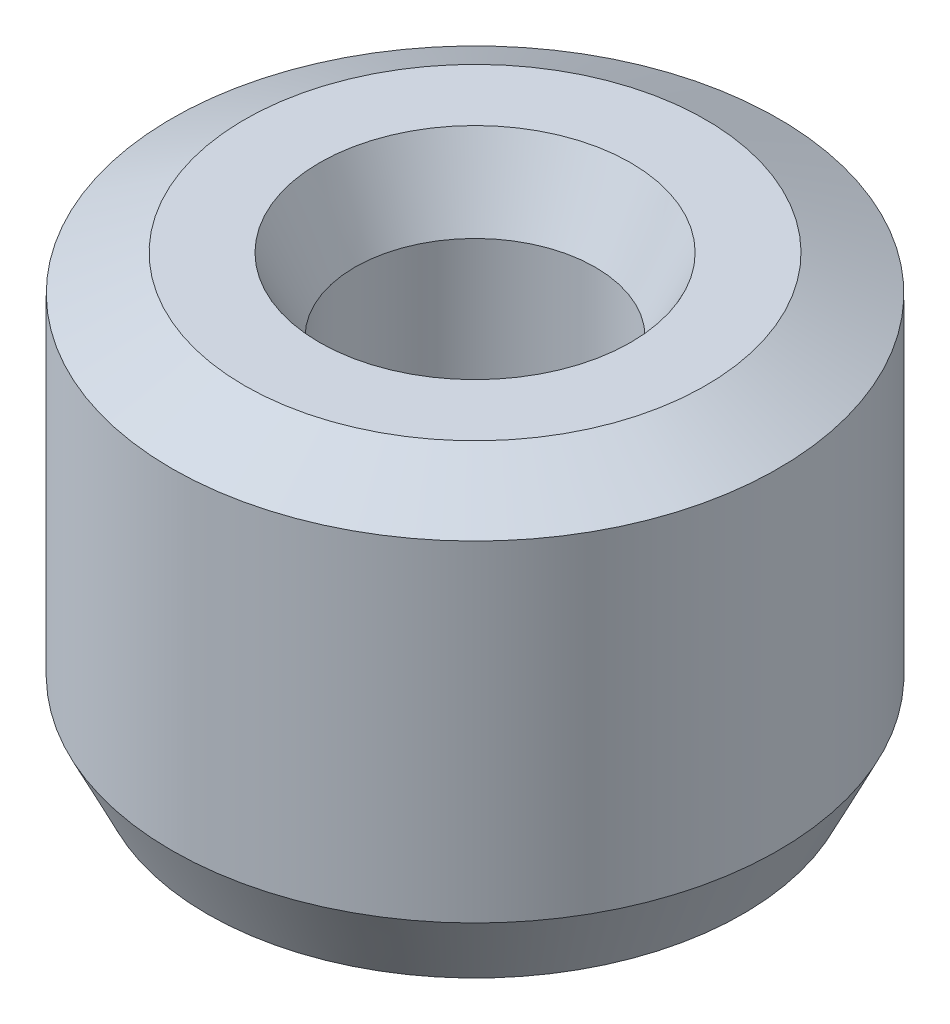
from build123d import *
from OCP.BRepFilletAPI import BRepFilletAPI_MakeChamfer

# Parameters (mm, degrees)
SKETCH1_R           = 12.5
BOSS_EXTRUDE1_DEPTH = 18.094022058
SKETCH2_R           = 4.955152252
CUT_EXTRUDE1_DEPTH  = 26.296118956
CHAMFER1_SIZE       = 1.460521096
CHAMFER1_SIZE2      = 2.997964707


with BuildPart() as part:
    # Sketch1 → Boss-Extrude1 (new body)
    with BuildSketch(Plane(origin=(0, 0, 0), x_dir=(1, 0, 0), z_dir=(0, 1, 0))):
        Circle(SKETCH1_R)
    extrude(amount=BOSS_EXTRUDE1_DEPTH)

    # Sketch2 → Cut-Extrude1 (cut, through all)
    with BuildSketch(Plane(origin=(0, 0, 0), x_dir=(1, 0, 0), z_dir=(0, 1, 0))):
        Circle(SKETCH2_R)
    extrude(amount=CUT_EXTRUDE1_DEPTH, mode=Mode.SUBTRACT)

    # Chamfer1: one chamfer whose edges measure the first distance from different faces: ONE call of the kernel's chamfer builder (chamfer() names one face for all edges)
    chamfer1_edges_1 = [part.edges().sort_by_distance(p)[0] for p in [
        (-4.955152252, 18.094022058, 0),
    ]]
    chamfer1_side_1 = [part.faces().sort_by_distance(p)[0] for p in [
        (-12.146446609, 18.094022058, 0),
    ]]
    chamfer1_edges_2 = [part.edges().sort_by_distance(p)[0] for p in [
        (-4.955152252, 0, 0),
    ]]
    chamfer1_side_2 = [part.faces().sort_by_distance(p)[0] for p in [
        (-4.955152252, 9.047011029, 0),
    ]]
    chamfer1_edges_3 = [part.edges().sort_by_distance(p)[0] for p in [
        (-12.5, 0, 0),
    ]]
    chamfer1_side_3 = [part.faces().sort_by_distance(p)[0] for p in [
        (-12.146446609, 0, 0),
    ]]
    chamfer1_edges_4 = [part.edges().sort_by_distance(p)[0] for p in [
        (-12.5, 18.094022058, 0),
    ]]
    chamfer1_side_4 = [part.faces().sort_by_distance(p)[0] for p in [
        (-12.5, 9.047011029, 0),
    ]]
    chamfer1 = BRepFilletAPI_MakeChamfer(part.part.solid().wrapped)
    for e in chamfer1_edges_1:
        chamfer1.Add(CHAMFER1_SIZE, CHAMFER1_SIZE2, e.wrapped, chamfer1_side_1[0].wrapped)  # the first distance lies on this face
    for e in chamfer1_edges_2:
        chamfer1.Add(CHAMFER1_SIZE, CHAMFER1_SIZE2, e.wrapped, chamfer1_side_2[0].wrapped)  # the first distance lies on this face
    for e in chamfer1_edges_3:
        chamfer1.Add(CHAMFER1_SIZE, CHAMFER1_SIZE2, e.wrapped, chamfer1_side_3[0].wrapped)  # the first distance lies on this face
    for e in chamfer1_edges_4:
        chamfer1.Add(CHAMFER1_SIZE, CHAMFER1_SIZE2, e.wrapped, chamfer1_side_4[0].wrapped)  # the first distance lies on this face
    add(Compound.cast(chamfer1.Shape()), mode=Mode.REPLACE)


solid = part.part
